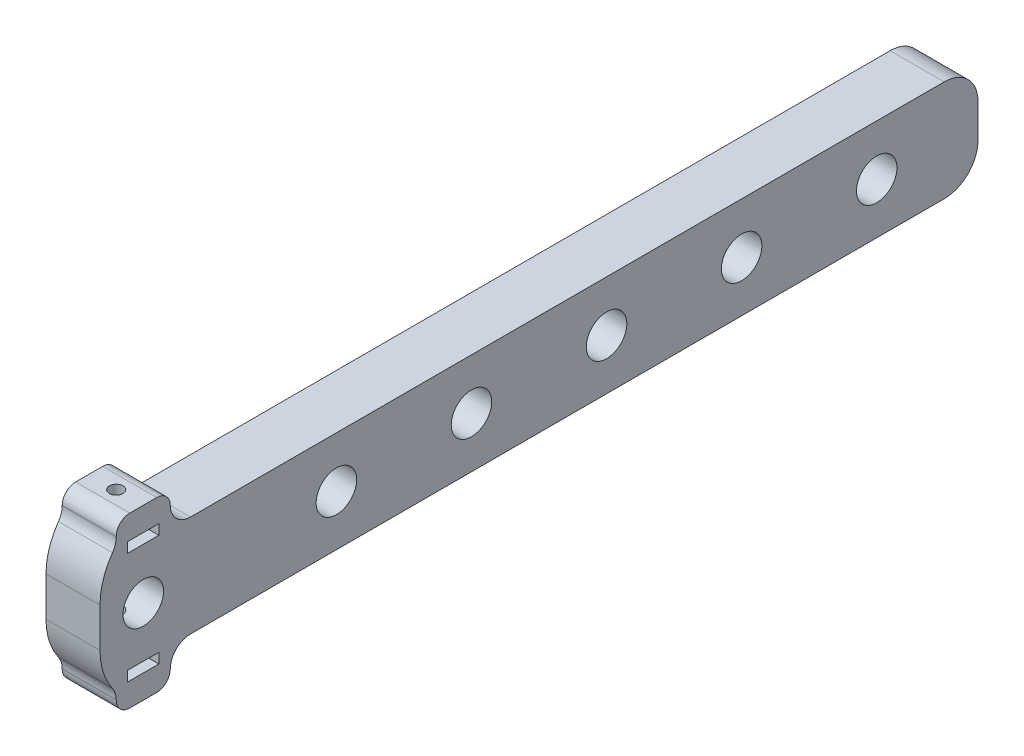
from build123d import *

# Parameters (mm, degrees)
SKETCH_1_W                = 130
SKETCH_1_H                = 15
EXTRUDE_1_DEPTH           = 8
CUT_EXTRUDE_10_REACH      = 133.107
SKETCH_17_R               = 3
CUT_EXTRUDE_12_REACH      = 133.107
SKETCH_15_R               = 3
SKETCH_22_W               = 8
SKETCH_22_H               = 8
EXTRUDE_7_DEPTH           = 5
CUT_EXTRUDE_18_DEPTH      = 1.5
SKETCH_25_W               = 4.62
SKETCH_25_H               = 1.5
CUT_EXTRUDE_19_DEPTH      = 4
FILLET_8_R                = 3
FILLET_9_R                = 2
FILLET_10_R               = 2
FILLET_11_R               = 3
CUT_EXTRUDE_20_DEPTH      = 15.5
CUT_EXTRUDE_20_DEPTH_BACK = 28.5
SKETCH_21_R               = 1
FILLET_12_R               = 10
FILLET_13_R               = 5


# Some blends are built 0.0001 mm under size
with BuildPart() as part:
    # 草图1 → 凸台-拉伸1 (new body)
    with BuildSketch(Plane(origin=(0, 0, 0), x_dir=(0, 0, -1), z_dir=(1, 0, 0))):
        with Locations((65, 7.5)):
            Rectangle(SKETCH_1_W, SKETCH_1_H)
    extrude(amount=EXTRUDE_1_DEPTH)

    # 草图17 → 切除-拉伸10 (cut, up to next)
    with BuildSketch(Plane.ZY, mode=Mode.PRIVATE) as cut_extrude_10_sk1:
        with Locations((-115, 7.5)):
            Circle(SKETCH_17_R)
    cut_extrude_10_tool1 = extrude(cut_extrude_10_sk1.sketch, amount=-CUT_EXTRUDE_10_REACH, mode=Mode.PRIVATE) & part.part
    # 草图17 → 切除-拉伸10 (cut, up to next)
    with BuildSketch(Plane.ZY, mode=Mode.PRIVATE) as cut_extrude_10_sk2:
        with Locations((-95, 7.5)):
            Circle(SKETCH_17_R)
    cut_extrude_10_tool2 = extrude(cut_extrude_10_sk2.sketch, amount=-CUT_EXTRUDE_10_REACH, mode=Mode.PRIVATE) & part.part
    # 草图17 → 切除-拉伸10 (cut, up to next)
    with BuildSketch(Plane.ZY, mode=Mode.PRIVATE) as cut_extrude_10_sk3:
        with Locations((-75, 7.5)):
            Circle(SKETCH_17_R)
    cut_extrude_10_tool3 = extrude(cut_extrude_10_sk3.sketch, amount=-CUT_EXTRUDE_10_REACH, mode=Mode.PRIVATE) & part.part
    # 草图17 → 切除-拉伸10 (cut, up to next)
    with BuildSketch(Plane.ZY, mode=Mode.PRIVATE) as cut_extrude_10_sk4:
        with Locations((-55, 7.5)):
            Circle(SKETCH_17_R)
    cut_extrude_10_tool4 = extrude(cut_extrude_10_sk4.sketch, amount=-CUT_EXTRUDE_10_REACH, mode=Mode.PRIVATE) & part.part
    # 草图17 → 切除-拉伸10 (cut, up to next)
    with BuildSketch(Plane.ZY, mode=Mode.PRIVATE) as cut_extrude_10_sk5:
        with Locations((-35, 7.5)):
            Circle(SKETCH_17_R)
    cut_extrude_10_tool5 = extrude(cut_extrude_10_sk5.sketch, amount=-CUT_EXTRUDE_10_REACH, mode=Mode.PRIVATE) & part.part
    add(cut_extrude_10_tool1.solids().sort_by_distance((0, 7.5, -115))[0], mode=Mode.SUBTRACT)
    add(cut_extrude_10_tool2.solids().sort_by_distance((0, 7.5, -95))[0], mode=Mode.SUBTRACT)
    add(cut_extrude_10_tool3.solids().sort_by_distance((0, 7.5, -75))[0], mode=Mode.SUBTRACT)
    add(cut_extrude_10_tool4.solids().sort_by_distance((0, 7.5, -55))[0], mode=Mode.SUBTRACT)
    add(cut_extrude_10_tool5.solids().sort_by_distance((0, 7.5, -35))[0], mode=Mode.SUBTRACT)

    # 草图15 → 切除-拉伸12 (cut, up to next)
    with BuildSketch(Plane.ZY, mode=Mode.PRIVATE) as cut_extrude_12_sk1:
        with Locations((-6.4, 7.5)):
            Circle(SKETCH_15_R)
    cut_extrude_12_tool1 = extrude(cut_extrude_12_sk1.sketch, amount=-CUT_EXTRUDE_12_REACH, mode=Mode.PRIVATE) & part.part
    add(cut_extrude_12_tool1.solids().sort_by_distance((0, 7.5, -6.4))[0], mode=Mode.SUBTRACT)

    # 草图22 → 凸台-拉伸7 (add)
    with BuildSketch(Plane(origin=(0, 15, 0), x_dir=(1, 0, 0), z_dir=(0, 1, 0))):
        with Locations((4, 6.4)):
            Rectangle(SKETCH_22_W, SKETCH_22_H)
    extrude_7 = extrude(amount=EXTRUDE_7_DEPTH)

    # 草图24 → 切除-拉伸18 (cut)
    with BuildSketch(Plane(origin=(0, 15, 0), x_dir=(1, 0, 0), z_dir=(0, 1, 0))):
        Polygon((4, 4.090598923), (6, 5.245299462), (6, 7.554700538), (4, 8.709401077), (2, 7.554700538), (2, 5.245299462), align=None)
    cut_extrude_18 = extrude(amount=CUT_EXTRUDE_18_DEPTH, mode=Mode.SUBTRACT)

    # 草图25 → 切除-拉伸19 (cut)
    with BuildSketch(Plane(origin=(8, 0, 0), x_dir=(0, 0, -1), z_dir=(1, 0, 0))):
        with Locations((6.4, 15.75)):
            Rectangle(SKETCH_25_W, SKETCH_25_H)
    cut_extrude_19 = extrude(amount=-CUT_EXTRUDE_19_DEPTH, mode=Mode.SUBTRACT)

    # 圆角8
    # the kernel refuses this fillet: 3 mm, written as the material it adds along each edge
    with BuildSketch(Plane(origin=(8, 15, -2.4), x_dir=(0, 1.5846583304811187e-12, 1.0), z_dir=(-1, 0, 0))) as fillet_8_piece_1:
        with BuildLine():
            CenterArc((3, 2.939387691), FILLET_8_R, 180, 78.463040967)
            Line((0, 2.939387691), (-0.06, 2.939387691))
            Line((-0.06, 2.939387691), (-0.06, 0))
            Line((-0.06, 0), (0, -0.06))
            ThreePointArc((0, -0.06), (1.2, -0.06), (2.388, -0.058787754))
            Line((2.388, -0.058787754), (2.4, 0))
        make_face()
    extrude(amount=8)
    with BuildSketch(Plane(origin=(0, 15, -10.4), x_dir=(0, 0, -1), z_dir=(1, 0, 0))) as fillet_8_piece_2:
        with BuildLine():
            CenterArc((FILLET_8_R, FILLET_8_R), FILLET_8_R, 180, 90)
            Line((0, FILLET_8_R), (-FILLET_8_R * 0.02, FILLET_8_R))
            Line((-FILLET_8_R * 0.02, FILLET_8_R), (-FILLET_8_R * 0.02, -FILLET_8_R * 0.02))
            Line((-FILLET_8_R * 0.02, -FILLET_8_R * 0.02), (FILLET_8_R, -FILLET_8_R * 0.02))
            Line((FILLET_8_R, -FILLET_8_R * 0.02), (FILLET_8_R, 0))
        make_face()
    extrude(amount=8)

    # 圆角9
    fillet_9_edges = [part.edges().sort_by_distance(p)[0] for p in [
        (4, 20, -2.4),
        (4, 20, -10.4),
    ]]
    fillet(fillet_9_edges, radius=FILLET_9_R - 0.0001)  # a hair under: the kernel refuses the full size

    # 镜向6: 凸台-拉伸7, 切除-拉伸18, 切除-拉伸19 across plane
    add(extrude_7.mirror(Plane.ZX.offset(7.5)))
    add(cut_extrude_18.mirror(Plane.ZX.offset(7.5)), mode=Mode.SUBTRACT)
    add(cut_extrude_19.mirror(Plane.ZX.offset(7.5)), mode=Mode.SUBTRACT)

    # 圆角10
    fillet_10_edges = [part.edges().sort_by_distance(p)[0] for p in [
        (4, -5, -10.4),
        (4, -5, -2.4),
    ]]
    fillet(fillet_10_edges, radius=FILLET_10_R)

    # 圆角11
    # the kernel refuses this fillet: 3 mm, written as the material it adds along each edge
    with BuildSketch(Plane(origin=(8, 0, -2.4), x_dir=(0, -1, 0), z_dir=(-1, 0, 0))) as fillet_11_piece_1:
        with BuildLine():
            CenterArc((2.939387691, 3), FILLET_11_R, 191.536959033, 78.463040967)
            Line((0, 2.4), (-0.058787754, 2.388))
            ThreePointArc((-0.058787754, 2.388), (-0.06, 1.2), (-0.06, 0))
            Line((-0.06, 0), (0, -0.06))
            Line((0, -0.06), (2.939387691, -0.06))
            Line((2.939387691, -0.06), (2.939387691, 0))
        make_face()
    extrude(amount=8)
    with BuildSketch(Plane(origin=(0, 0, -10.4), x_dir=(0, -1, 0), z_dir=(1, 0, 0))) as fillet_11_piece_2:
        with BuildLine():
            CenterArc((FILLET_11_R, FILLET_11_R), FILLET_11_R, 180, 90)
            Line((0, FILLET_11_R), (-FILLET_11_R * 0.02, FILLET_11_R))
            Line((-FILLET_11_R * 0.02, FILLET_11_R), (-FILLET_11_R * 0.02, -FILLET_11_R * 0.02))
            Line((-FILLET_11_R * 0.02, -FILLET_11_R * 0.02), (FILLET_11_R, -FILLET_11_R * 0.02))
            Line((FILLET_11_R, -FILLET_11_R * 0.02), (FILLET_11_R, 0))
        make_face()
    extrude(amount=8)

    # 草图21 → 切除-拉伸20 (cut, two sides: drawn at the far end of the back side and taken through both)
    with BuildSketch(Plane(origin=(0, 15, 0), x_dir=(1, 0, 0), z_dir=(0, 1, 0)).offset(-CUT_EXTRUDE_20_DEPTH_BACK)):
        with Locations(Location((4, 6.4, 0), (0, 0, 90))):
            Circle(SKETCH_21_R)
    extrude(amount=CUT_EXTRUDE_20_DEPTH + CUT_EXTRUDE_20_DEPTH_BACK, mode=Mode.SUBTRACT)

    # 圆角12
    fillet_12_edges = [part.edges().sort_by_distance(p)[0] for p in [
        (4, 15, 0),
        (4, 0, 0),
    ]]
    fillet(fillet_12_edges, radius=FILLET_12_R)

    # 圆角13
    fillet_13_edges = [part.edges().sort_by_distance(p)[0] for p in [
        (4, 15, -130),
        (4, 0, -130),
    ]]
    fillet(fillet_13_edges, radius=FILLET_13_R)


solid = part.part
